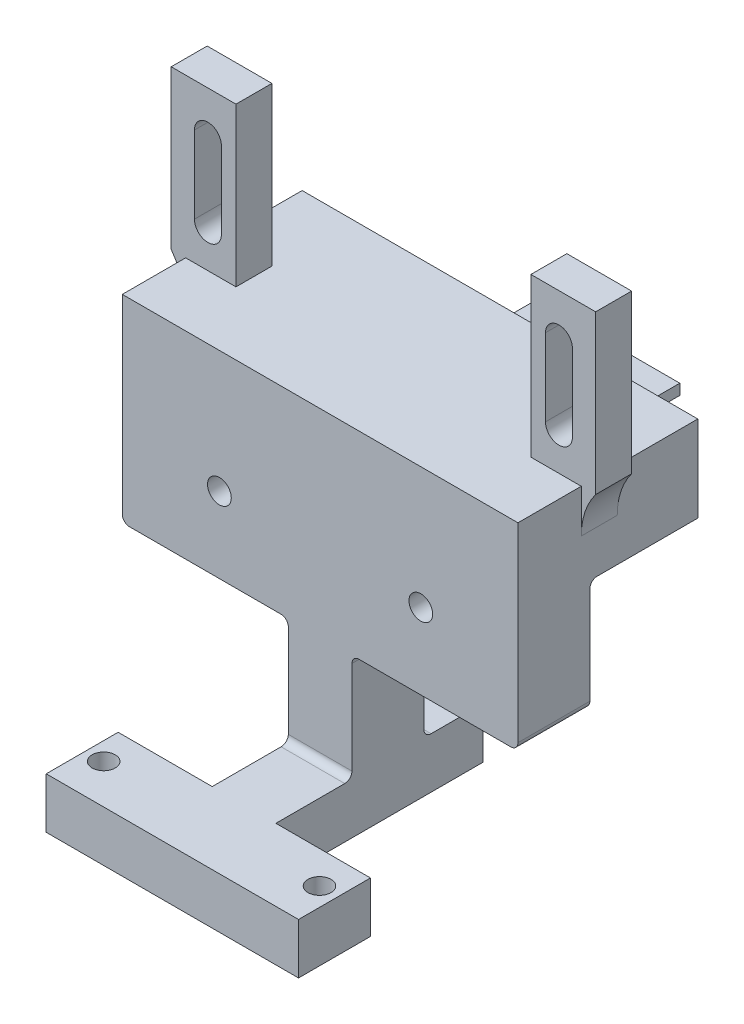
from build123d import *

# Parameters (mm, degrees)
SKETCH_1_W            = 35
SKETCH_1_H            = 40
EXTRUDE_1_DEPTH       = 5
SKETCH_2_W            = 20
SKETCH_2_H            = 20
EXTRUDE_2_DEPTH       = 65
SKETCH_3_W            = 56
SKETCH_3_H            = 11
SKETCH_3_W_2          = 4.5
CUT_EXTRUDE_1_DEPTH   = 78.821912081
SKETCH_5_W            = 55
SKETCH_5_H            = 20
EXTRUDE_3_DEPTH       = 25
SKETCH_9_R            = 1.65
CUT_EXTRUDE_3_DEPTH   = 27
SKETCH_10_W           = 55
SKETCH_10_H           = 25
EXTRUDE_4_DEPTH       = 4.9
SKETCH_11_W           = 7
SKETCH_11_H           = 5
EXTRUDE_5_DEPTH       = 21
CHAMFER_2_SIZE        = 10
CHAMFER_3_SIZE        = 3
CHAMFER_4_SIZE        = 2
CUT_EXTRUDE_7_DEPTH   = 15
SKETCH_16_W           = 12.984556049
SKETCH_16_H           = 11
EXTRUDE_6_DEPTH       = 20
CHAMFER_5_SIZE        = 3
SKETCH_19_R           = 1.6
CUT_EXTRUDE_10_DEPTH  = 10
FILLET_1_R            = 5
SKETCH_20_W           = 5
SKETCH_20_H           = 22.5
EXTRUDE_7_DEPTH       = 17.5
SKETCH_21_W           = 5
SKETCH_21_H           = 22.5
EXTRUDE_8_DEPTH       = 5
SKETCH_22_W           = 5
SKETCH_22_H           = 22.5
EXTRUDE_9_DEPTH       = 10
SKETCH_23_W           = 5
SKETCH_23_H           = 22.5
EXTRUDE_10_DEPTH      = 10
SKETCH_24_W           = 3.3
SKETCH_24_H           = 22.5
EXTRUDE_11_DEPTH      = 4
SKETCH_26_W           = 5
SKETCH_26_H           = 22.5
EXTRUDE_13_DEPTH      = 17.5
SKETCH_27_W           = 5
SKETCH_27_H           = 22.5
EXTRUDE_14_DEPTH      = 5
SKETCH_28_W           = 5
SKETCH_28_H           = 22.5
EXTRUDE_15_DEPTH      = 10
SKETCH_29_W           = 5
SKETCH_29_H           = 22.5
EXTRUDE_16_DEPTH      = 10
SKETCH_31_W           = 3.4
SKETCH_31_H           = 22.5
EXTRUDE_18_DEPTH      = 4
SKETCH_39_W           = 7.13678645
SKETCH_39_H           = 13.518332953
SKETCH_39_W_2         = 8.139264071
SKETCH_39_H_2         = 10.52230198
CUT_EXTRUDE_17_DEPTH  = 35
SKETCH_40_W           = 55
SKETCH_40_H           = 10
EXTRUDE_20_DEPTH      = 25.575713879
SKETCH_41_W           = 8.84873954
SKETCH_41_H           = 7.046133319
EXTRUDE_21_DEPTH      = 20.577981656
EXTRUDE_22_DEPTH      = 13.07563
EXTRUDE_22_DEPTH_BACK = 22
SKETCH_42_W           = 38.79276714
SKETCH_42_H           = 7.046133319
SKETCH_43_W           = 23.07563023
SKETCH_43_H           = 28.79276714
CUT_EXTRUDE_18_DEPTH  = 22
FILLET_3_R            = 1
SKETCH_46_W           = 9.238205764
SKETCH_46_H           = 22.5
EXTRUDE_26_DEPTH      = 10
CUT_EXTRUDE_19_DEPTH  = 10
SKETCH_48_R           = 1.6
CUT_EXTRUDE_20_DEPTH  = 10
CUT_EXTRUDE_21_DEPTH  = 10
SKETCH_50_W           = 2.57104036
SKETCH_50_H           = 22.5
SKETCH_50_W_2         = 2.865096637
EXTRUDE_27_DEPTH      = 10
SKETCH_53_W           = 4.304606657
SKETCH_53_H           = 10
SKETCH_53_W_2         = 2.865096637
EXTRUDE_28_DEPTH      = 11
SKETCH_51_R           = 1.6
CUT_EXTRUDE_22_DEPTH  = 12
SKETCH_52_W           = 17.2
SKETCH_52_H           = 6.8
CUT_EXTRUDE_23_DEPTH  = 39
CUT_EXTRUDE_24_DEPTH  = 10
SKETCH_55_W           = 32
SKETCH_55_H           = 22.5
EXTRUDE_29_DEPTH      = 12
SKETCH_56_W           = 10.301119562
SKETCH_56_H           = 22.5
CUT_EXTRUDE_25_DEPTH  = 7
SKETCH_57_W           = 3
SKETCH_57_H           = 4.95
EXTRUDE_30_DEPTH      = 8
SKETCH_58_W           = 9
SKETCH_58_H           = 22.5
SKETCH_58_W_2         = 8.434386946
CUT_EXTRUDE_26_DEPTH  = 10.05
CUT_EXTRUDE_27_DEPTH  = 1
SKETCH_60_W           = 2.55
SKETCH_60_H           = 22.5
EXTRUDE_31_DEPTH      = 12
SKETCH_61_W           = 3.965384327
SKETCH_61_H           = 22.5
CUT_EXTRUDE_28_DEPTH  = 6.95
SKETCH_62_W           = 5
SKETCH_62_H           = 22
EXTRUDE_32_DEPTH      = 2
SKETCH_63_W           = 5
SKETCH_63_H           = 22
EXTRUDE_33_DEPTH      = 2
SKETCH_64_W           = 5
SKETCH_64_H           = 22.5
EXTRUDE_34_DEPTH      = 8
SKETCH_65_W           = 0.1
SKETCH_65_H           = 22.5
CUT_EXTRUDE_30_DEPTH  = 15
SKETCH_66_W           = 5
SKETCH_66_H           = 22.5
EXTRUDE_35_DEPTH      = 8
SKETCH_67_R           = 1.1
CUT_EXTRUDE_31_DEPTH  = 9
SKETCH_68_W           = 0.1
SKETCH_68_H           = 22.5
CUT_EXTRUDE_32_DEPTH  = 12
SKETCH_69_W           = 12
SKETCH_69_H           = 22.5
EXTRUDE_36_DEPTH      = 5
SKETCH_70_W           = 107.728068616
SKETCH_70_H           = 75.066227262
CUT_EXTRUDE_33_DEPTH  = 130
SKETCH_73_W           = 6.7
SKETCH_73_H           = 9
CUT_EXTRUDE_34_DEPTH  = 19
FILLET_5_R            = 10
SKETCH_75_W           = 20
SKETCH_75_H           = 11.957252994
SKETCH_75_W_2         = 6.7
SKETCH_75_H_2         = 9
EXTRUDE_38_DEPTH      = 15
CUT_EXTRUDE_35_DEPTH  = 20
SKETCH_76_W           = 3.65
SKETCH_76_H           = 9
CUT_EXTRUDE_36_DEPTH  = 25
FILLET_6_R            = 10
CHAMFER_6_SIZE        = 5


with BuildPart() as part:
    # 草图1 → 凸台-拉伸1 (new body)
    with BuildSketch(Plane.XY):
        Rectangle(SKETCH_1_W, SKETCH_1_H)
    extrude(amount=EXTRUDE_1_DEPTH)

    # 草图2 → 凸台-拉伸2 (add)
    with BuildSketch(Plane.XY.offset(5)):
        Rectangle(SKETCH_2_W, SKETCH_2_H)
    extrude(amount=EXTRUDE_2_DEPTH)

    # 草图3 → 切除-拉伸1 (cut, through all)
    with BuildSketch(Plane.ZY.offset(10)):
        with Locations((37.5, 0)):
            Rectangle(SKETCH_3_W, SKETCH_3_H)
        with Locations((7.25, 0)):
            Rectangle(SKETCH_3_W_2, SKETCH_3_H)
    extrude(amount=-CUT_EXTRUDE_1_DEPTH, mode=Mode.SUBTRACT)

    # 草图5 → 凸台-拉伸3 (add)
    with BuildSketch(Plane.XY.offset(70)):
        Rectangle(SKETCH_5_W, SKETCH_5_H)
    extrude(amount=EXTRUDE_3_DEPTH)

    # 草图9 → 切除-拉伸3 (cut)
    with BuildSketch(Plane.XY.offset(95)):
        with Locations((-14, -3.042747006)):
            Circle(SKETCH_9_R)
        with Locations((14, -3.042747006)):
            Circle(SKETCH_9_R)
    extrude(amount=-CUT_EXTRUDE_3_DEPTH, mode=Mode.SUBTRACT)

    # 草图10 → 凸台-拉伸4 (add)
    with BuildSketch(Plane(origin=(0, 10, 0), x_dir=(1, 0, 0), z_dir=(0, 1, 0))):
        with Locations((0, -82.5)):
            Rectangle(SKETCH_10_W, SKETCH_10_H)
    extrude(amount=EXTRUDE_4_DEPTH)

    # 草图11 → 凸台-拉伸5 (add)
    with BuildSketch(Plane(origin=(0, 14.9, 0), x_dir=(1, 0, 0), z_dir=(0, 1, 0))):
        with Locations((-24, -83.7)):
            Rectangle(SKETCH_11_W, SKETCH_11_H)
        with Locations((24, -83.7)):
            Rectangle(SKETCH_11_W, SKETCH_11_H)
    extrude(amount=EXTRUDE_5_DEPTH)

    # 倒角2
    chamfer_2_edges = [part.edges().sort_by_distance(p)[0] for p in [
        (0, -5.5, 65.5),
    ]]
    chamfer(chamfer_2_edges, length=CHAMFER_2_SIZE)

    # 倒角3
    chamfer_3_edges = [part.edges().sort_by_distance(p)[0] for p in [
        (0, 10, 70),
    ]]
    chamfer(chamfer_3_edges, length=CHAMFER_3_SIZE)

    # 倒角4
    chamfer_4_edges = [part.edges().sort_by_distance(p)[0] for p in [
        (0, -10, 5),
    ]]
    chamfer(chamfer_4_edges, length=CHAMFER_4_SIZE)

    # 草图15 → 切除-拉伸7 (cut)
    with BuildSketch(Plane(origin=(0, 0, 70), x_dir=(-1, 0, 0), z_dir=(0, 0, -1))):
        Polygon((10, 1.957252994), (29.13083687, 1.957252994), (29.13083687, -8.042747006), (29.13083687, -10), (10, -10), (10, -8.042747006), align=None)
        Polygon((-29.13083687, 1.957252994), (-29.13083687, -8.042747006), (-29.13083687, -10), (-10, -10), (-10, -8.042747006), (-10, 1.957252994), align=None)
    extrude(amount=-CUT_EXTRUDE_7_DEPTH, mode=Mode.SUBTRACT)

    # 草图16 → 凸台-拉伸6 (add)
    with BuildSketch(Plane.ZY.offset(10)):
        with Locations((11.492278025, 0)):
            Rectangle(SKETCH_16_W, SKETCH_16_H)
    extrude(amount=-EXTRUDE_6_DEPTH)

    # 倒角5
    chamfer_5_edges = [part.edges().sort_by_distance(p)[0] for p in [
        (0, 5.5, 17.984556049),
    ]]
    chamfer(chamfer_5_edges, length=CHAMFER_5_SIZE)

    # 草图19 → 切除-拉伸10 (cut)
    with BuildSketch(Plane.XY.offset(86.2)):
        with Locations((-24.4, 29.9)):
            Circle(SKETCH_19_R)
        with Locations((-24.4, 19.9)):
            Circle(SKETCH_19_R)
        with Locations((24.4, 19.9)):
            Circle(SKETCH_19_R)
        with Locations((24.4, 29.9)):
            Circle(SKETCH_19_R)
    extrude(amount=-CUT_EXTRUDE_10_DEPTH, mode=Mode.SUBTRACT)

    # 圆角1
    fillet_1_edges = [part.edges().sort_by_distance(p)[0] for p in [
        (17.5, -20, 2.5),
        (-17.5, -20, 2.5),
        (-17.5, 20, 2.5),
        (17.5, 20, 2.5),
    ]]
    fillet(fillet_1_edges, radius=FILLET_1_R)

    # 草图20 → 凸台-拉伸7 (add)
    with BuildSketch(Plane.ZY.offset(17.5)):
        with Locations((2.5, 0)):
            Rectangle(SKETCH_20_W, SKETCH_20_H)
    extrude(amount=EXTRUDE_7_DEPTH)

    # 草图21 → 凸台-拉伸8 (add)
    with BuildSketch(Plane.ZY.offset(35)):
        with Locations((2.5, 0)):
            Rectangle(SKETCH_21_W, SKETCH_21_H)
    extrude(amount=EXTRUDE_8_DEPTH)

    # 草图22 → 凸台-拉伸9 (add)
    with BuildSketch(Plane(origin=(0, 0, 0), x_dir=(-1, 0, 0), z_dir=(0, 0, -1))):
        with Locations((37.5, 0)):
            Rectangle(SKETCH_22_W, SKETCH_22_H)
    extrude(amount=EXTRUDE_9_DEPTH)

    # 草图23 → 凸台-拉伸10 (add)
    with BuildSketch(Plane(origin=(0, 0, 0), x_dir=(-1, 0, 0), z_dir=(0, 0, -1))):
        with Locations((15.5, 0)):
            Rectangle(SKETCH_23_W, SKETCH_23_H)
    extrude(amount=EXTRUDE_10_DEPTH)

    # 草图24 → 凸台-拉伸11 (add)
    with BuildSketch(Plane.ZY.offset(18)):
        with Locations((-8.35, 0)):
            Rectangle(SKETCH_24_W, SKETCH_24_H)
    extrude(amount=EXTRUDE_11_DEPTH)

    # 草图26 → 凸台-拉伸13 (add)
    with BuildSketch(Plane(origin=(17.5, 0, 0), x_dir=(0, 0, -1), z_dir=(1, 0, 0))):
        with Locations((-2.5, 0)):
            Rectangle(SKETCH_26_W, SKETCH_26_H)
    extrude(amount=EXTRUDE_13_DEPTH)

    # 草图27 → 凸台-拉伸14 (add)
    with BuildSketch(Plane(origin=(35, 0, 0), x_dir=(0, 0, -1), z_dir=(1, 0, 0))):
        with Locations((-2.5, 0)):
            Rectangle(SKETCH_27_W, SKETCH_27_H)
    extrude(amount=EXTRUDE_14_DEPTH)

    # 草图28 → 凸台-拉伸15 (add)
    with BuildSketch(Plane(origin=(0, 0, 0), x_dir=(-1, 0, 0), z_dir=(0, 0, -1))):
        with Locations((-37.5, 0)):
            Rectangle(SKETCH_28_W, SKETCH_28_H)
    extrude(amount=EXTRUDE_15_DEPTH)

    # 草图29 → 凸台-拉伸16 (add)
    with BuildSketch(Plane(origin=(0, 0, 0), x_dir=(-1, 0, 0), z_dir=(0, 0, -1))):
        with Locations((-15.5, 0)):
            Rectangle(SKETCH_29_W, SKETCH_29_H)
    extrude(amount=EXTRUDE_16_DEPTH)

    # 草图31 → 凸台-拉伸18 (add)
    with BuildSketch(Plane(origin=(18, 0, 0), x_dir=(0, 0, -1), z_dir=(1, 0, 0))):
        with Locations((8.3, 0)):
            Rectangle(SKETCH_31_W, SKETCH_31_H)
    extrude(amount=EXTRUDE_18_DEPTH)

    # 草图39 → 切除-拉伸17 (cut)
    with BuildSketch(Plane.ZY.offset(17.5)):
        with Locations((3.568393225, 18.009166476)):
            Rectangle(SKETCH_39_W, SKETCH_39_H)
        with Locations((4.069632036, -16.51115099)):
            Rectangle(SKETCH_39_W_2, SKETCH_39_H_2)
    extrude(amount=-CUT_EXTRUDE_17_DEPTH, mode=Mode.SUBTRACT)

    # 草图40 → 凸台-拉伸20 (add)
    with BuildSketch(Plane.XZ.offset(10)):
        with Locations((0, 90)):
            Rectangle(SKETCH_40_W, SKETCH_40_H)
    extrude(amount=EXTRUDE_20_DEPTH)

    # 草图41 → 凸台-拉伸21 (add)
    with BuildSketch(Plane.XY.offset(95)):
        with Locations((0, -32.05264722)):
            Rectangle(SKETCH_41_W, SKETCH_41_H)
    extrude(amount=EXTRUDE_21_DEPTH)

    # 草图42 → 凸台-拉伸22 (add, two sides: drawn at the far end of the back side and taken through both)
    with BuildSketch(Plane.ZY.offset(4.42436977).offset(-EXTRUDE_22_DEPTH_BACK)):
        with Locations((96.181598086, -32.05264722)):
            Rectangle(SKETCH_42_W, SKETCH_42_H)
    extrude(amount=EXTRUDE_22_DEPTH + EXTRUDE_22_DEPTH_BACK)

    # 草图43 → 切除-拉伸18 (cut)
    with BuildSketch(Plane.XZ.offset(35.575713879)):
        with Locations((15.962184885, 91.181598086)):
            Rectangle(SKETCH_43_W, SKETCH_43_H)
        with Locations((-15.962184885, 91.181598086)):
            Rectangle(SKETCH_43_W, SKETCH_43_H)
    extrude(amount=-CUT_EXTRUDE_18_DEPTH, mode=Mode.SUBTRACT)

    # 圆角3
    fillet_3_edges = [part.edges().sort_by_distance(p)[0] for p in [
        (-18.75, 1.957252994, 85),
        (18.75, 1.957252994, 85),
        (0, -10, 85),
        (0, -28.52958056, 85),
        (0, -28.52958056, 95),
        (27.5, -13.575713879, 90),
        (4.42436977, -13.575713879, 90),
        (-27.5, -13.575713879, 90),
        (-4.42436977, -13.575713879, 90),
    ]]
    fillet(fillet_3_edges, radius=FILLET_3_R)

    # 草图46 → 凸台-拉伸26 (add)
    with BuildSketch(Plane(origin=(0, 0, 0), x_dir=(-1, 0, 0), z_dir=(0, 0, -1))):
        with Locations((-8.380897118, 0)):
            Rectangle(SKETCH_46_W, SKETCH_46_H)
    extrude(amount=EXTRUDE_26_DEPTH)

    # 草图47 → 切除-拉伸19 (cut)
    with BuildSketch(Plane(origin=(0, 0, -10), x_dir=(-1, 0, 0), z_dir=(0, 0, -1))):
        with BuildLine():
            Line((-8.066400893, 11.25), (-10.700516417, 11.25))
            Line((-10.700516417, 11.25), (-10.700516417, -11.25))
            Line((-10.700516417, -11.25), (-6.332834596, -11.25))
            ThreePointArc((-6.332834596, -11.25), (-6.663682414, -9.62836823), (-8.066400893, -8.75))
            Line((-8.066400893, -8.75), (-8.066400893, -7.900028072))
            ThreePointArc((-8.066400893, -7.900028072), (-6.289381928, -5.825014036), (-8.066400893, -3.75))
            Line((-8.066400893, -3.75), (-8.066400893, -2.900028072))
            ThreePointArc((-8.066400893, -2.900028072), (-6.289381928, -0.825014036), (-8.066400893, 1.25))
            Line((-8.066400893, 1.25), (-8.066400893, 2.099971928))
            ThreePointArc((-8.066400893, 2.099971928), (-6.289381928, 4.174985964), (-8.066400893, 6.25))
            Line((-8.066400893, 6.25), (-8.066400893, 7.099971928))
            ThreePointArc((-8.066400893, 7.099971928), (-6.289381928, 9.174985964), (-8.066400893, 11.25))
        make_face()
    extrude(amount=-CUT_EXTRUDE_19_DEPTH, mode=Mode.SUBTRACT)

    # 草图48 → 切除-拉伸20 (cut)
    with BuildSketch(Plane(origin=(0, -28.52958056, 0), x_dir=(1, 0, 0), z_dir=(0, 1, 0))):
        with Locations(Location((15, -110.089556655, 0), (0, 0, 270))):
            Circle(SKETCH_48_R)
        with Locations(Location((-15, -110.089556655, 0), (0, 0, 270))):
            Circle(SKETCH_48_R)
    extrude(amount=-CUT_EXTRUDE_20_DEPTH, mode=Mode.SUBTRACT)

    # 草图49 → 切除-拉伸21 (cut)
    with BuildSketch(Plane.XY.offset(86.2)):
        with BuildLine():
            Line((-22.528691915, 29.9), (-22.528691915, 19.165676086))
            ThreePointArc((-22.528691915, 19.165676086), (-24.4, 17.294368), (-26.271308085, 19.165676086))
            Line((-26.271308085, 19.165676086), (-26.271308085, 29.9))
            ThreePointArc((-26.271308085, 29.9), (-24.4, 31.771308085), (-22.528691915, 29.9))
        make_face()
        with BuildLine():
            Line((22.528691915, 29.9), (22.528691915, 19.165676086))
            ThreePointArc((22.528691915, 19.165676086), (24.4, 17.294368), (26.271308085, 19.165676086))
            Line((26.271308085, 19.165676086), (26.271308085, 29.9))
            ThreePointArc((26.271308085, 29.9), (24.4, 31.771308085), (22.528691915, 29.9))
        make_face()
    extrude(amount=-CUT_EXTRUDE_21_DEPTH, mode=Mode.SUBTRACT)

    # 草图50 → 凸台-拉伸27 (add)
    with BuildSketch(Plane(origin=(0, 0, -10), x_dir=(-1, 0, 0), z_dir=(0, 0, -1))):
        with Locations((-5.047314416, 0)):
            Rectangle(SKETCH_50_W, SKETCH_50_H)
        with Locations((-12.133064736, 0)):
            Rectangle(SKETCH_50_W_2, SKETCH_50_H)
    extrude(amount=EXTRUDE_27_DEPTH)

    # 草图53 → 凸台-拉伸28 (add)
    with BuildSketch(Plane(origin=(0, 11.25, 0), x_dir=(1, 0, 0), z_dir=(0, 1, 0))):
        with Locations((5.914097565, 5)):
            Rectangle(SKETCH_53_W, SKETCH_53_H)
        with Locations((12.133064736, 5)):
            Rectangle(SKETCH_53_W_2, SKETCH_53_H)
    extrude(amount=EXTRUDE_28_DEPTH)

    # 草图51 → 切除-拉伸22 (cut)
    with BuildSketch(Plane(origin=(13.565613054, 0, 0), x_dir=(0, 0, -1), z_dir=(1, 0, 0))):
        with Locations((16, 6.25)):
            Circle(SKETCH_51_R)
        with Locations((16, -6.25)):
            Circle(SKETCH_51_R)
    extrude(amount=-CUT_EXTRUDE_22_DEPTH, mode=Mode.SUBTRACT)

    # 草图52 → 切除-拉伸23 (cut)
    with BuildSketch(Plane(origin=(0, 11.25, 0), x_dir=(1, 0, 0), z_dir=(0, 1, 0))):
        with Locations((-26.5, 3.35)):
            Rectangle(SKETCH_52_W, SKETCH_52_H)
        with Locations((26.5, 3.35)):
            Rectangle(SKETCH_52_W, SKETCH_52_H)
    extrude(amount=-CUT_EXTRUDE_23_DEPTH, mode=Mode.SUBTRACT)

    # 草图54 → 切除-拉伸24 (cut)
    with BuildSketch(Plane(origin=(0, 0, -10), x_dir=(-1, 0, 0), z_dir=(0, 0, -1))):
        with BuildLine():
            ThreePointArc((-8.066400893, 12.099971928), (-6.289381928, 14.174985964), (-8.066400893, 16.25))
            Line((-8.066400893, 16.25), (-8.066400893, 12.099971928))
        make_face()
        with BuildLine():
            ThreePointArc((-8.066400893, 17.099971928), (-6.289381928, 19.174985964), (-8.066400893, 21.25))
            Line((-8.066400893, 21.25), (-8.066400893, 17.099971928))
        make_face()
    extrude(amount=-CUT_EXTRUDE_24_DEPTH, mode=Mode.SUBTRACT)

    # 草图55 → 凸台-拉伸29 (add)
    with BuildSketch(Plane.XY.offset(5)):
        Rectangle(SKETCH_55_W, SKETCH_55_H)
    extrude(amount=EXTRUDE_29_DEPTH)

    # 草图56 → 切除-拉伸25 (cut)
    with BuildSketch(Plane(origin=(0, 0, 0), x_dir=(-1, 0, 0), z_dir=(0, 0, -1))):
        with Locations((7.849440219, 0)):
            Rectangle(SKETCH_56_W, SKETCH_56_H)
    extrude(amount=-CUT_EXTRUDE_25_DEPTH, mode=Mode.SUBTRACT)

    # 草图57 → 凸台-拉伸30 (add)
    with BuildSketch(Plane(origin=(0, 11.25, 0), x_dir=(1, 0, 0), z_dir=(0, 1, 0))):
        with Locations((-18.465384327, -2.525)):
            Rectangle(SKETCH_57_W, SKETCH_57_H)
        with Locations((-34.665384327, -2.525)):
            Rectangle(SKETCH_57_W, SKETCH_57_H)
    extrude(amount=EXTRUDE_30_DEPTH)

    # 草图58 → 切除-拉伸26 (cut)
    with BuildSketch(Plane(origin=(0, 0, -10), x_dir=(-1, 0, 0), z_dir=(0, 0, -1))):
        with Locations((17.5, 0)):
            Rectangle(SKETCH_58_W, SKETCH_58_H)
        with Locations((-17.782806527, 0)):
            Rectangle(SKETCH_58_W_2, SKETCH_58_H)
    extrude(amount=-CUT_EXTRUDE_26_DEPTH, mode=Mode.SUBTRACT)

    # 草图59 → 切除-拉伸27 (cut)
    with BuildSketch(Plane(origin=(0, 14.9, 0), x_dir=(1, 0, 0), z_dir=(0, 1, 0))):
        Polygon((20.5, -86.2), (20.5, -81.2), (27.5, -81.2), (27.5, -70), (-27.5, -70), (-27.5, -81.2), (-20.5, -81.2), (-20.5, -86.2), (-27.5, -86.2), (-27.5, -95), (27.5, -95), (27.5, -86.2), align=None)
    extrude(amount=-CUT_EXTRUDE_27_DEPTH, mode=Mode.SUBTRACT)

    # 草图60 → 凸台-拉伸31 (add)
    with BuildSketch(Plane.XY.offset(5)):
        with Locations((-17.275, 0)):
            Rectangle(SKETCH_60_W, SKETCH_60_H)
        with Locations((17.275, 0)):
            Rectangle(SKETCH_60_W, SKETCH_60_H)
    extrude(amount=EXTRUDE_31_DEPTH)

    # 草图61 → 切除-拉伸28 (cut)
    with BuildSketch(Plane(origin=(0, 0, 0.05), x_dir=(-1, 0, 0), z_dir=(0, 0, -1))):
        with Locations((14.982692164, 0)):
            Rectangle(SKETCH_61_W, SKETCH_61_H)
    extrude(amount=-CUT_EXTRUDE_28_DEPTH, mode=Mode.SUBTRACT)

    # 草图62 → 凸台-拉伸32 (add)
    with BuildSketch(Plane.ZY.offset(27.5)):
        with Locations((83.7, 24.9)):
            Rectangle(SKETCH_62_W, SKETCH_62_H)
    extrude(amount=EXTRUDE_32_DEPTH)

    # 草图63 → 凸台-拉伸33 (add)
    with BuildSketch(Plane(origin=(27.5, 0, 0), x_dir=(0, 0, -1), z_dir=(1, 0, 0))):
        with Locations((-83.7, 24.9)):
            Rectangle(SKETCH_63_W, SKETCH_63_H)
    extrude(amount=EXTRUDE_33_DEPTH)

    # 草图64 → 凸台-拉伸34 (add)
    with BuildSketch(Plane(origin=(0, 0, -10), x_dir=(-1, 0, 0), z_dir=(0, 0, -1))):
        with Locations((-37.5, 0)):
            Rectangle(SKETCH_64_W, SKETCH_64_H)
    extrude(amount=EXTRUDE_34_DEPTH)

    # 草图65 → 切除-拉伸30 (cut)
    with BuildSketch(Plane(origin=(0, 0, -18), x_dir=(-1, 0, 0), z_dir=(0, 0, -1))):
        with Locations((-35.05, 0)):
            Rectangle(SKETCH_65_W, SKETCH_65_H)
    extrude(amount=-CUT_EXTRUDE_30_DEPTH, mode=Mode.SUBTRACT)

    # 草图66 → 凸台-拉伸35 (add)
    with BuildSketch(Plane(origin=(0, 0, -10), x_dir=(-1, 0, 0), z_dir=(0, 0, -1))):
        with Locations((37.5, 0)):
            Rectangle(SKETCH_66_W, SKETCH_66_H)
    extrude(amount=EXTRUDE_35_DEPTH)

    # 草图67 → 切除-拉伸31 (cut)
    with BuildSketch(Plane(origin=(40, 0, 0), x_dir=(0, 0, -1), z_dir=(1, 0, 0))):
        with Locations(Location((2.45, 4.25, 0), (0, 0, 90))):
            Circle(SKETCH_67_R)
        with Locations(Location((2.45, -3.75, 0), (0, 0, 90))):
            Circle(SKETCH_67_R)
        with Locations(Location((14.45, -3.75, 0), (0, 0, 90))):
            Circle(SKETCH_67_R)
        with Locations(Location((14.45, 4.25, 0), (0, 0, 90))):
            Circle(SKETCH_67_R)
    cut_extrude_31 = extrude(amount=-CUT_EXTRUDE_31_DEPTH, mode=Mode.SUBTRACT)

    # 镜向1: 切除-拉伸31 across plane
    add(cut_extrude_31.mirror(Plane(origin=(0, 0, 0), x_dir=(0, 0, 1), z_dir=(1, 0, 0))), mode=Mode.SUBTRACT)

    # 草图68 → 切除-拉伸32 (cut)
    with BuildSketch(Plane(origin=(0, 0, -18), x_dir=(-1, 0, 0), z_dir=(0, 0, -1))):
        with Locations((35.05, 0)):
            Rectangle(SKETCH_68_W, SKETCH_68_H)
    extrude(amount=-CUT_EXTRUDE_32_DEPTH, mode=Mode.SUBTRACT)

    # 草图69 → 凸台-拉伸36 (add)
    with BuildSketch(Plane.ZY.offset(18.55)):
        with Locations((11, 0)):
            Rectangle(SKETCH_69_W, SKETCH_69_H)
    extrude(amount=EXTRUDE_36_DEPTH)

    # 草图70 → 切除-拉伸33 (cut)
    with BuildSketch(Plane(origin=(0, 0, 70), x_dir=(-1, 0, 0), z_dir=(0, 0, -1))):
        Rectangle(SKETCH_70_W, SKETCH_70_H)
    extrude(amount=CUT_EXTRUDE_33_DEPTH, mode=Mode.SUBTRACT)

    # 草图73 → 切除-拉伸34 (cut)
    with BuildSketch(Plane(origin=(0, 0, 70), x_dir=(-1, 0, 0), z_dir=(0, 0, -1))):
        with Locations((0, -4.021373503)):
            Rectangle(SKETCH_73_W, SKETCH_73_H)
    extrude(amount=-CUT_EXTRUDE_34_DEPTH, mode=Mode.SUBTRACT)

    # 圆角5
    # the kernel refuses this fillet: 10 mm, written as the material it adds along each edge
    with BuildSketch(Plane(origin=(-27.5, 13.9, 86.2), x_dir=(0, -1, 0), z_dir=(0, 0, -1)), Plane(origin=(27.5, 13.9, 81.2), x_dir=(0, -1, 0), z_dir=(0, 0, 1))) as fillet_5_piece_1:
        with BuildLine():
            CenterArc((6, 10), FILLET_5_R, 233.130102354, 36.869897646)
            Line((0, 2), (0, 0))
            Line((0, 0), (6, 0))
        make_face()
    extrude(amount=5)

    # 草图75 → 凸台-拉伸38 (add)
    with BuildSketch(Plane(origin=(0, 0, 70), x_dir=(-1, 0, 0), z_dir=(0, 0, -1))):
        with Locations((0, -4.021373503)):
            Rectangle(SKETCH_75_W, SKETCH_75_H)
        with Locations((0, -4.021373503)):
            Rectangle(SKETCH_75_W_2, SKETCH_75_H_2, mode=Mode.SUBTRACT)
    extrude(amount=EXTRUDE_38_DEPTH)

    # 草图74 → 切除-拉伸35 (cut)
    with BuildSketch(Plane(origin=(10, 0, 0), x_dir=(0, 0, -1), z_dir=(1, 0, 0))):
        with BuildLine():
            Line((-82.596309624, -2.421373503), (-58.15800679, -2.421373503))
            ThreePointArc((-58.15800679, -2.421373503), (-56.55800679, -4.021373503), (-58.15800679, -5.621373503))
            Line((-58.15800679, -5.621373503), (-82.596309624, -5.621373503))
            ThreePointArc((-82.596309624, -5.621373503), (-84.196309624, -4.021373503), (-82.596309624, -2.421373503))
        make_face()
    extrude(amount=-CUT_EXTRUDE_35_DEPTH, mode=Mode.SUBTRACT)

    # 草图76 → 切除-拉伸36 (cut)
    with BuildSketch(Plane(origin=(0, 0, 55), x_dir=(-1, 0, 0), z_dir=(0, 0, -1))):
        with Locations((-8.175, -4.021373503)):
            Rectangle(SKETCH_76_W, SKETCH_76_H)
        with Locations((8.175, -4.021373503)):
            Rectangle(SKETCH_76_W, SKETCH_76_H)
    extrude(amount=-CUT_EXTRUDE_36_DEPTH, mode=Mode.SUBTRACT)

    # 圆角6
    # the kernel refuses this fillet: 10 mm, written as the material it adds along each edge
    with BuildSketch(Plane(origin=(-6.35, 0.478626497, 80), x_dir=(-1, 0, 0), z_dir=(0, -1, 0))) as fillet_6_piece_1:
        with BuildLine():
            CenterArc((10, 7.725121358), FILLET_6_R, 180, 50.580015533)
            Line((0, 7.725121358), (0, 0))
            Line((0, 0), (3.65, 0))
        make_face()
    extrude(amount=2.9)
    with BuildSketch(Plane(origin=(6.35, 0.478626497, 80), x_dir=(1, 0, 0), z_dir=(0, -1, 0))) as fillet_6_piece_2:
        with BuildLine():
            CenterArc((10, -7.725121358), FILLET_6_R, 129.419984467, 50.580015533)
            Line((0, -7.725121358), (0, 0))
            Line((0, 0), (3.65, 0))
        make_face()
    extrude(amount=2.9)

    # 倒角6
    chamfer_6_edges = [part.edges().sort_by_distance(p)[0] for p in [
        (0, 1.957252994, 70),
    ]]
    chamfer(chamfer_6_edges, length=CHAMFER_6_SIZE)


solid = part.part
